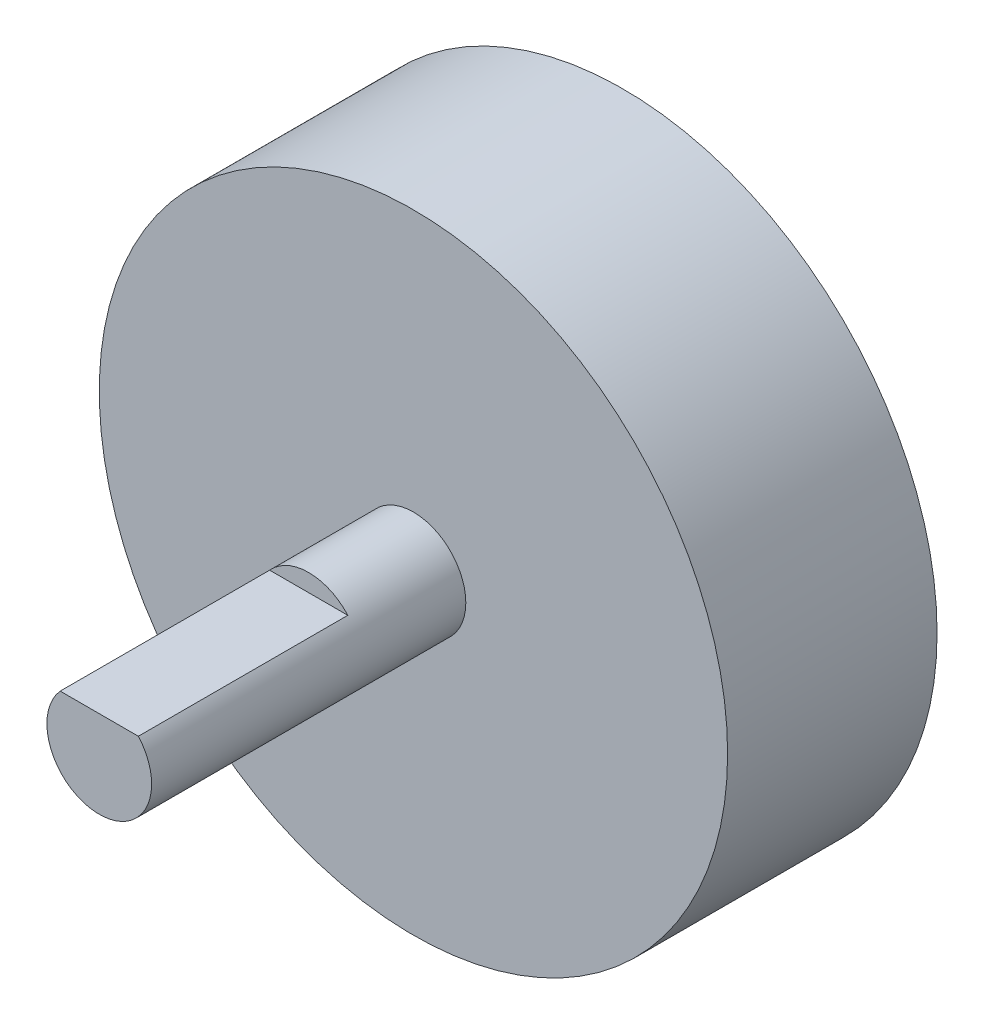
from build123d import *

# Parameters (mm, degrees)
SKETCH1_R           = 19.05
BOSS_EXTRUDE1_DEPTH = 12.7
SKETCH2_R           = 3.175
BOSS_EXTRUDE2_DEPTH = 19.05
SKETCH3_W           = 7.575380866
SKETCH3_H           = 1.446687318
CUT_EXTRUDE1_DEPTH  = 12.7


with BuildPart() as part:
    # Sketch1 → Boss-Extrude1 (new body)
    with BuildSketch(Plane.XY):
        Circle(SKETCH1_R)
    extrude(amount=BOSS_EXTRUDE1_DEPTH)

    # Sketch2 → Boss-Extrude2 (add)
    with BuildSketch(Plane.XY.offset(12.7)):
        Circle(SKETCH2_R)
    extrude(amount=BOSS_EXTRUDE2_DEPTH)

    # Sketch3 → Cut-Extrude1 (cut)
    with BuildSketch(Plane.XY.offset(31.75)):
        with Locations((0.155919731, 2.835726074)):
            Rectangle(SKETCH3_W, SKETCH3_H)
    extrude(amount=-CUT_EXTRUDE1_DEPTH, mode=Mode.SUBTRACT)


solid = part.part
